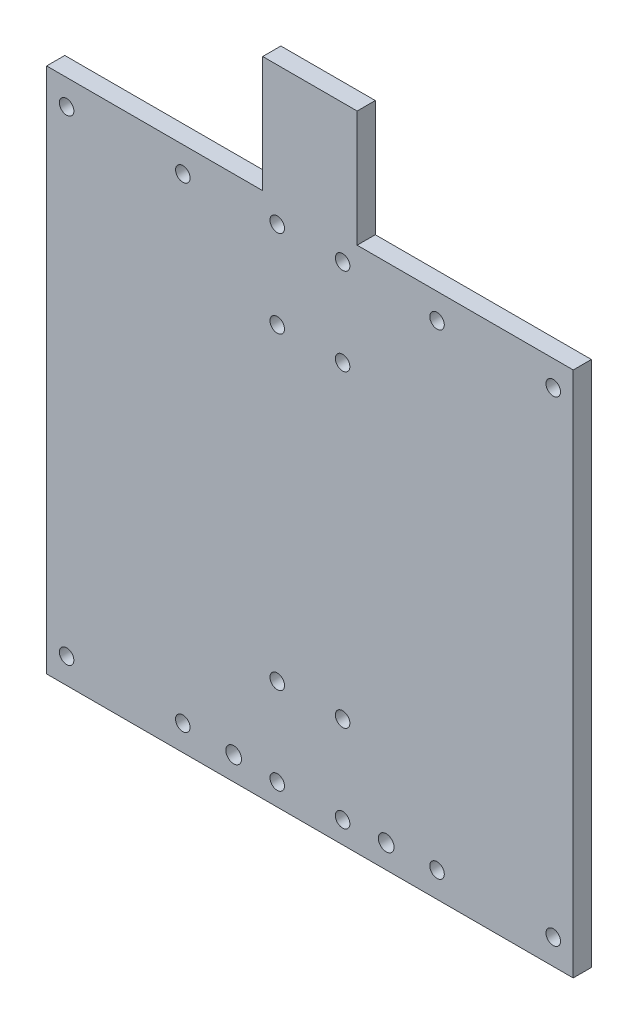
from build123d import *

# Parameters (mm, degrees)
SKETCH1_R           = 2
SKETCH1_R_2         = 2.162090294
BOSS_EXTRUDE1_DEPTH = 5


with BuildPart() as part:
    # Sketch1 → Boss-Extrude1 (new body)
    with BuildSketch(Plane.XY):
        Polygon((-72.5, 72.5), (-13, 72.5), (-13, 104.5), (13, 104.5), (13, 72.5), (72.5, 72.5), (72.5, -72.5), (-72.5, -72.5), align=None)
        with Locations((9, 42.5)):
            Circle(SKETCH1_R, mode=Mode.SUBTRACT)
        with Locations((-9, 42.5)):
            Circle(SKETCH1_R, mode=Mode.SUBTRACT)
        with Locations((-9, 66.5)):
            Circle(SKETCH1_R, mode=Mode.SUBTRACT)
        with Locations((9, 66.5)):
            Circle(SKETCH1_R, mode=Mode.SUBTRACT)
        with Locations((9, -66.5)):
            Circle(SKETCH1_R, mode=Mode.SUBTRACT)
        with Locations((-9, -66.5)):
            Circle(SKETCH1_R, mode=Mode.SUBTRACT)
        with Locations((-9, -42.5)):
            Circle(SKETCH1_R, mode=Mode.SUBTRACT)
        with Locations((9, -42.5)):
            Circle(SKETCH1_R, mode=Mode.SUBTRACT)
        with Locations((-21, -66)):
            Circle(SKETCH1_R_2, mode=Mode.SUBTRACT)
        with Locations((21, -66)):
            Circle(SKETCH1_R_2, mode=Mode.SUBTRACT)
        with Locations((35, -65.5)):
            Circle(SKETCH1_R, mode=Mode.SUBTRACT)
        with Locations((67, -65.5)):
            Circle(SKETCH1_R, mode=Mode.SUBTRACT)
        with Locations((-67, -65.5)):
            Circle(SKETCH1_R, mode=Mode.SUBTRACT)
        with Locations((-35, -65.5)):
            Circle(SKETCH1_R, mode=Mode.SUBTRACT)
        with Locations((-67, 65.5)):
            Circle(SKETCH1_R, mode=Mode.SUBTRACT)
        with Locations((-35, 65.5)):
            Circle(SKETCH1_R, mode=Mode.SUBTRACT)
        with Locations((67, 65.5)):
            Circle(SKETCH1_R, mode=Mode.SUBTRACT)
        with Locations((35, 65.5)):
            Circle(SKETCH1_R, mode=Mode.SUBTRACT)
    extrude(amount=BOSS_EXTRUDE1_DEPTH)


solid = part.part
